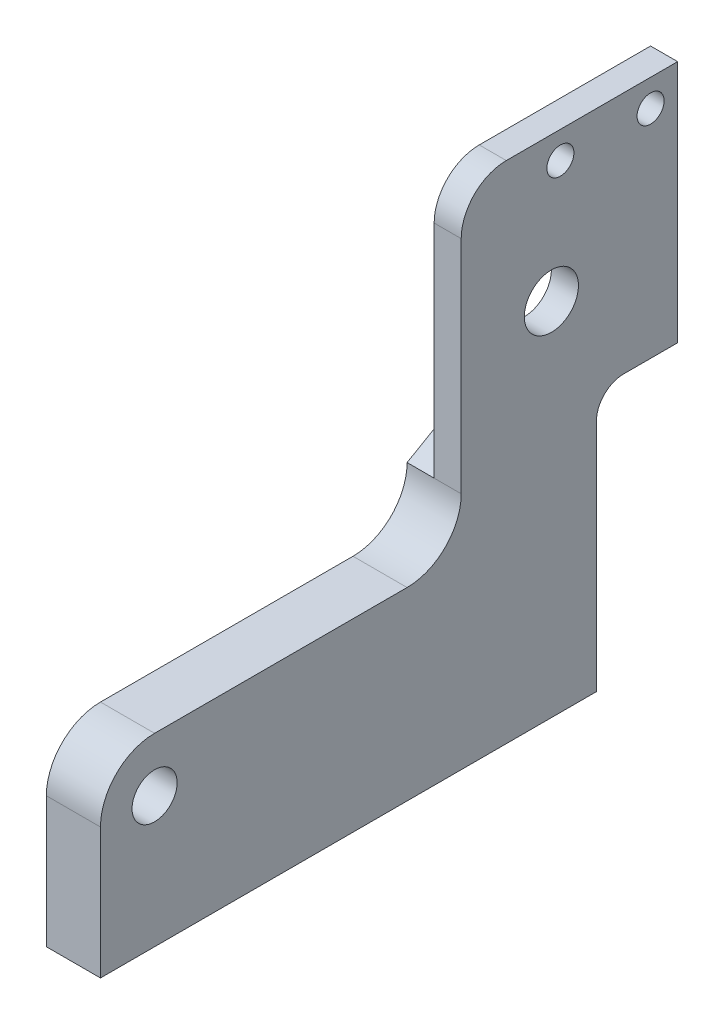
from build123d import *

# Parameters (mm, degrees)
SKETCH1_W                   = 64
SKETCH1_H                   = 56
SKETCH1_R                   = 2.5
SKETCH1_R_2                 = 3
BOSS_EXTRUDE1_DEPTH         = 6
CUT_EXTRUDE1_REACH          = 87.253
CUT_EXTRUDE2_REACH          = 87.253
SKETCH3_W                   = 9
SKETCH3_H                   = 29
FILLET1_R                   = 5
FILLET2_R                   = 3
TAP_DRILL_FOR_M3_TAP1_D     = 2.5
TAP_DRILL_FOR_M3_TAP1_DEPTH = 10
TAP_DRILL_FOR_M3_TAP1_TIP   = 0.751075774
CUT_EXTRUDE3_DEPTH          = 3
CUT_EXTRUDE4_REACH          = 87.094
SKETCH10_R                  = 1.5


with BuildPart() as part:
    # Sketch1 → Boss-Extrude1 (new body)
    with BuildSketch(Plane(origin=(0, 0, 0), x_dir=(0, 0, -1), z_dir=(1, 0, 0))):
        with Locations((32, 28)):
            Rectangle(SKETCH1_W, SKETCH1_H)
        with Locations((6, 14.5)):
            Circle(SKETCH1_R, mode=Mode.SUBTRACT)
        with Locations((50, 40)):
            Circle(SKETCH1_R_2, mode=Mode.SUBTRACT)
    extrude(amount=BOSS_EXTRUDE1_DEPTH)

    # Sketch2 → Cut-Extrude1 (cut, up to next)
    with BuildSketch(Plane(origin=(6, 0, 0), x_dir=(0, 0, -1), z_dir=(1, 0, 0)), mode=Mode.PRIVATE) as cut_extrude1_sk1:
        with BuildLine():
            Line((6, 20.5), (34, 20.5))
            ThreePointArc((34, 20.5), (38.242640687, 22.257359313), (40, 26.5))
            Line((40, 26.5), (40, 57))
            Line((40, 57), (0, 57))
            Line((0, 57), (0, 14.5))
            ThreePointArc((0, 14.5), (1.757359313, 18.742640687), (6, 20.5))
        make_face()
    cut_extrude1_tool1 = extrude(cut_extrude1_sk1.sketch, amount=-CUT_EXTRUDE1_REACH, mode=Mode.PRIVATE) & part.part
    add(cut_extrude1_tool1.solids().sort_by_distance((6, 38.735816, -19.802521))[0], mode=Mode.SUBTRACT)

    # Sketch3 → Cut-Extrude2 (cut, up to next)
    with BuildSketch(Plane(origin=(6, 0, 0), x_dir=(0, 0, -1), z_dir=(1, 0, 0)), mode=Mode.PRIVATE) as cut_extrude2_sk1:
        with Locations((59.5, 14.5)):
            Rectangle(SKETCH3_W, SKETCH3_H)
    cut_extrude2_tool1 = extrude(cut_extrude2_sk1.sketch, amount=-CUT_EXTRUDE2_REACH, mode=Mode.PRIVATE) & part.part
    add(cut_extrude2_tool1.solids().sort_by_distance((6, 14.5, -59.5))[0], mode=Mode.SUBTRACT)

    # Fillet1
    fillet1_edges = [part.edges().sort_by_distance(p)[0] for p in [
        (3, 56, -40),
    ]]
    fillet(fillet1_edges, radius=FILLET1_R)

    # Fillet2
    fillet2_edges = [part.edges().sort_by_distance(p)[0] for p in [
        (3, 29, -55),
    ]]
    fillet(fillet2_edges, radius=FILLET2_R)

    # Tap Drill for M3 Tap1
    with Locations(Plane(origin=(0, 0, 0), x_dir=(-1, 0, 0), z_dir=(0, -1, 0))):
        with Locations((-3, 48), (-3, 12)):
            Hole(TAP_DRILL_FOR_M3_TAP1_D / 2, depth=TAP_DRILL_FOR_M3_TAP1_DEPTH)
            with Locations((0, 0, -(TAP_DRILL_FOR_M3_TAP1_DEPTH + TAP_DRILL_FOR_M3_TAP1_TIP / 2))):  # 118° drill point
                Cone(0, TAP_DRILL_FOR_M3_TAP1_D / 2, TAP_DRILL_FOR_M3_TAP1_TIP, mode=Mode.SUBTRACT)

    # Sketch9 → Cut-Extrude3 (cut)
    with BuildSketch(Plane.ZY):
        Polygon((-64, 56), (-64, 33.42820323), (-52, 33.42820323), (-40, 26.5), (-40, 56), align=None)
    extrude(amount=-CUT_EXTRUDE3_DEPTH, mode=Mode.SUBTRACT)

    # Sketch10 → Cut-Extrude4 (cut, up to next)
    with BuildSketch(Plane.ZY.offset(-3), mode=Mode.PRIVATE) as cut_extrude4_sk1:
        with Locations((-61, 53)):
            Circle(SKETCH10_R)
    cut_extrude4_tool1 = extrude(cut_extrude4_sk1.sketch, amount=-CUT_EXTRUDE4_REACH, mode=Mode.PRIVATE) & part.part
    # Sketch10 → Cut-Extrude4 (cut, up to next)
    with BuildSketch(Plane.ZY.offset(-3), mode=Mode.PRIVATE) as cut_extrude4_sk2:
        with Locations((-51, 53)):
            Circle(SKETCH10_R)
    cut_extrude4_tool2 = extrude(cut_extrude4_sk2.sketch, amount=-CUT_EXTRUDE4_REACH, mode=Mode.PRIVATE) & part.part
    add(cut_extrude4_tool1.solids().sort_by_distance((3, 53, -61))[0], mode=Mode.SUBTRACT)
    add(cut_extrude4_tool2.solids().sort_by_distance((3, 53, -51))[0], mode=Mode.SUBTRACT)


solid = part.part
